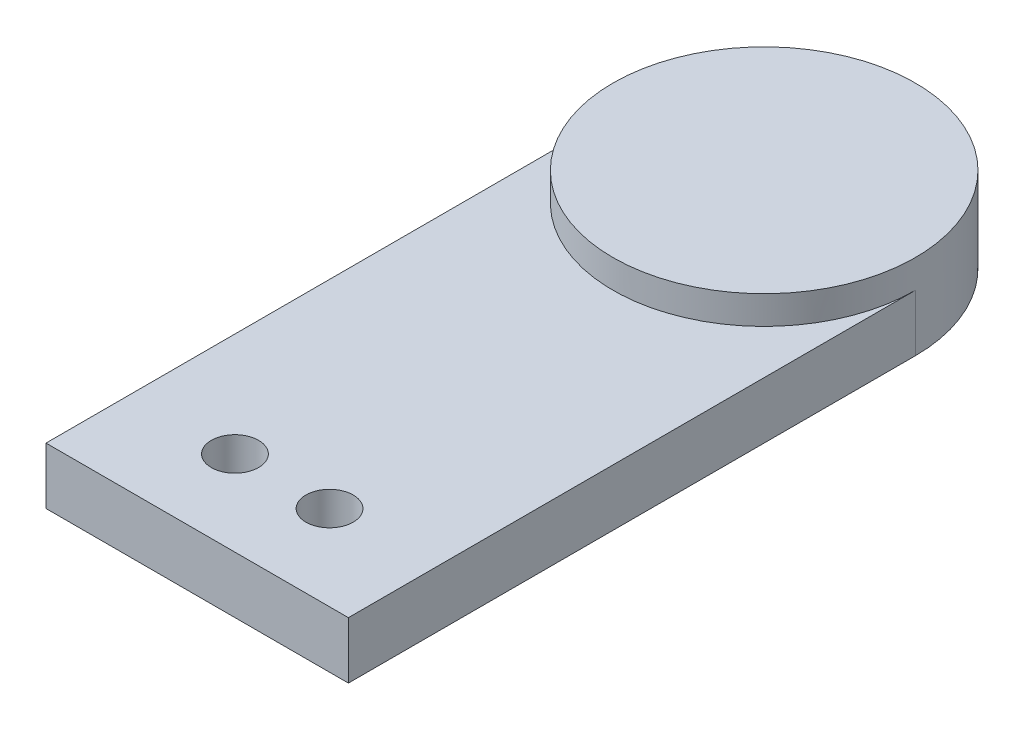
from build123d import *

# Parameters (mm, degrees)
BOSS_EXTRUDE1_DEPTH      = 3
BOSS_EXTRUDE1_DEPTH_BACK = 1.5
SKETCH1_R                = 8
SKETCH2_W                = 16
SKETCH2_H                = 30
BOSS_EXTRUDE2_DEPTH      = 1.5
CUT_EXTRUDE1_REACH       = 33.373
SKETCH3_R                = 1.25


with BuildPart() as part:
    # Sketch1 → Boss-Extrude1 (new, two sides: drawn at the far end of the back side and taken through both)
    with BuildSketch(Plane(origin=(0, 0, 0), x_dir=(1, 0, 0), z_dir=(0, 1, 0)).offset(-BOSS_EXTRUDE1_DEPTH_BACK)):
        Circle(SKETCH1_R)
    extrude(amount=BOSS_EXTRUDE1_DEPTH + BOSS_EXTRUDE1_DEPTH_BACK)

    # Sketch2 → Boss-Extrude2 (add, symmetric)
    with BuildSketch(Plane(origin=(0, 0, 0), x_dir=(1, 0, 0), z_dir=(0, 1, 0))):
        with Locations((0, -15)):
            Rectangle(SKETCH2_W, SKETCH2_H)
    extrude(amount=BOSS_EXTRUDE2_DEPTH, both=True)

    # Sketch3 → Cut-Extrude1 (cut, up to next)
    with BuildSketch(Plane(origin=(0, -1.5, 0), x_dir=(-1, 0, 0), z_dir=(0, -1, 0)), mode=Mode.PRIVATE) as cut_extrude1_sk1:
        with Locations((2.503073418, -25.5)):
            Circle(SKETCH3_R)
    cut_extrude1_tool1 = extrude(cut_extrude1_sk1.sketch, amount=-CUT_EXTRUDE1_REACH, mode=Mode.PRIVATE) & part.part
    # Sketch3 → Cut-Extrude1 (cut, up to next)
    with BuildSketch(Plane(origin=(0, -1.5, 0), x_dir=(-1, 0, 0), z_dir=(0, -1, 0)), mode=Mode.PRIVATE) as cut_extrude1_sk2:
        with Locations((-2.503073418, -25.5)):
            Circle(SKETCH3_R)
    cut_extrude1_tool2 = extrude(cut_extrude1_sk2.sketch, amount=-CUT_EXTRUDE1_REACH, mode=Mode.PRIVATE) & part.part
    add(cut_extrude1_tool1.solids().sort_by_distance((-2.503073, -1.5, 25.5))[0], mode=Mode.SUBTRACT)
    add(cut_extrude1_tool2.solids().sort_by_distance((2.503073, -1.5, 25.5))[0], mode=Mode.SUBTRACT)

    # Sketch4 → Cut-Revolve21 (revolve, cut)
    with BuildSketch(Plane(origin=(0, -1.5, 0), x_dir=(-1, 0, 0), z_dir=(0, -1, 0))):
        with BuildLine():
            Line((3.3, 0), (-3.3, 0))
            ThreePointArc((-3.3, 0), (0, -3.3), (3.3, 0))
        make_face()
    revolve(axis=Axis((3.3, -1.5, 0), (-1, 0, 0)), mode=Mode.SUBTRACT)


solid = part.part
